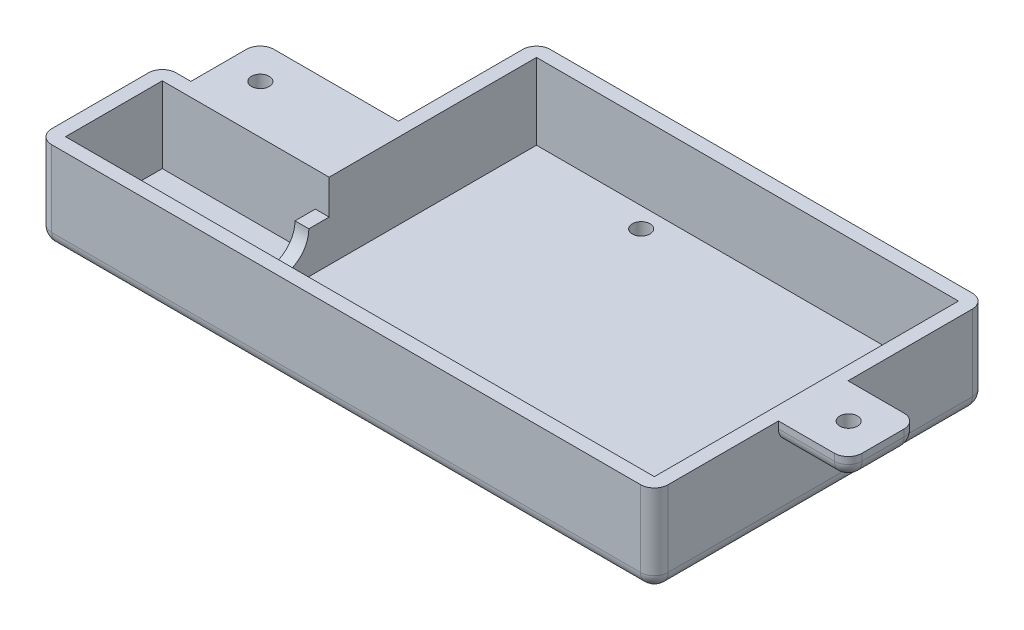
from build123d import *

# Parameters (mm, degrees)
STOCK_LED_START                   = -2.54
STOCK_LED_LIGHT_HOUSING_1_DEPTH   = 2.54
STOCK_LED_LIGHT_HOUSING_1_2_DEPTH = 13.97
SKETCH3_W                         = 2.54
SKETCH3_H                         = 17.78
PIECE_UNDER_BATTERY_PLUG_DEPTH    = 7.62
CUT_OUT_FOR_PLUG_REACH            = 94.065
SKETCH4_R                         = 5.157413323
HOLES_FOR_SCREWS_D                = 3.2639
SKETCH7_W                         = 25.4
SKETCH7_H                         = 12.726484406
SKETCH7_W_2                       = 12.813224924
SKETCH7_H_2                       = 12.784135739
NAILS_GO_HERE_DEPTH               = 3.81
NAIL_HOLES_D                      = 3.2639
FILLET1_R                         = 2.54


# Read off the part's stored shape, not the designer's step: Stock-LED Light housing-1
with BuildPart() as part:
    # Stock-LED Light housing-1 outline → Stock-LED Light housing-1 (new body)
    with BuildSketch(Plane(origin=(0, 0, 0), x_dir=(1, 0, 0), z_dir=(0, 1, 0)).offset(STOCK_LED_START)):
        Polygon((71.203772107, -22.802348667), (71.203772107, 38.157651333), (-11.408866572, 38.157651333), (-11.408866572, 0.057651333), (-42.066153873, 0.057651333), (-42.066153873, -22.802348667), align=None)
    extrude(amount=STOCK_LED_LIGHT_HOUSING_1_DEPTH)

    # Stock-LED Light housing-1 2 outline → Stock-LED Light housing-1 2 (add)
    with BuildSketch(Plane(origin=(0, 0, 0), x_dir=(1, 0, 0), z_dir=(0, 1, 0))):
        Polygon((71.203772107, -22.802348667), (71.203772107, 38.157651333), (-11.408866572, 38.157651333), (-11.408866572, 0.057651333), (-42.066153873, 0.057651333), (-42.066153873, -22.802348667), align=None)
        Polygon((-39.526153873, -20.262348667), (-39.526153873, -2.482348667), (-8.868866572, -2.482348667), (-8.868866572, 35.617651333), (68.663772107, 35.617651333), (68.663772107, -20.262348667), align=None, mode=Mode.SUBTRACT)
    extrude(amount=STOCK_LED_LIGHT_HOUSING_1_2_DEPTH)

    # Sketch3 → Piece under battery plug (add)
    with BuildSketch(Plane(origin=(0, 0, 0), x_dir=(1, 0, 0), z_dir=(0, 1, 0))):
        with Locations((-10.138866572, -11.372348667)):
            Rectangle(SKETCH3_W, SKETCH3_H)
    extrude(amount=PIECE_UNDER_BATTERY_PLUG_DEPTH)

    # Sketch4 → Cut out for plug (cut, up to next)
    with BuildSketch(Plane(origin=(-11.408866572, 0, 0), x_dir=(0, 0, -1), z_dir=(1, 0, 0)), mode=Mode.PRIVATE) as cut_out_for_plug_sk1:
        with Locations((-11.372348667, 7.62)):
            Circle(SKETCH4_R)
    cut_out_for_plug_tool1 = extrude(cut_out_for_plug_sk1.sketch, amount=CUT_OUT_FOR_PLUG_REACH, mode=Mode.PRIVATE) & part.part
    add(cut_out_for_plug_tool1.solids().sort_by_distance((-11.408867, 7.62, 11.372349))[0], mode=Mode.SUBTRACT)

    # holes for screws (through all)
    with Locations(Plane(origin=(0, 0, 0), x_dir=(1, 0, 0), z_dir=(0, 1, 0))):
        with Locations((14.053772107, 31.922137324), (12.783772107, -16.337862676), (64.853772107, -11.257862676), (64.853772107, 16.682137324)):
            Hole(HOLES_FOR_SCREWS_D / 2)

    # Sketch7 → Nails go here (add)
    with BuildSketch(Plane(origin=(0, 13.97, 0), x_dir=(1, 0, 0), z_dir=(0, 1, 0))):
        with Locations((-24.108866572, 6.420893536)):
            Rectangle(SKETCH7_W, SKETCH7_H)
        with Locations((77.610384569, 6.39206787)):
            Rectangle(SKETCH7_W_2, SKETCH7_H_2)
    extrude(amount=-NAILS_GO_HERE_DEPTH)

    # Nail holes (through all)
    with Locations(Plane(origin=(0, 10.16, 0), x_dir=(-1, 0, 0), z_dir=(0, -1, 0))):
        with Locations((30.430786564, 6.434135739), (-77.666997031, 6.434135739)):
            Hole(NAIL_HOLES_D / 2)

    # Fillet1
    fillet1_edges = [part.edges().sort_by_distance(p)[0] for p in [
        (71.203772107, 5.715, -38.157651333),
        (71.203772107, 5.715, 22.802348667),
        (-36.808866572, 10.16, -6.420893536),
        (-24.108866572, 10.16, -12.784135739),
        (-36.808866572, 12.065, -12.784135739),
        (77.610384569, 10.16, -12.784135739),
        (84.016997031, 10.16, -6.392067869),
        (84.016997031, 12.065, -12.784135739),
        (77.610384569, 10.16, 0),
        (84.016997031, 12.065, 0),
        (-26.737510222, -2.54, -0.057651333),
        (14.568809117, -2.54, 22.802348667),
        (29.897452767, -2.54, -38.157651333),
        (-42.066153873, 5.715, 22.802348667),
        (-42.066153873, 5.715, -0.057651333),
        (-42.066153873, -2.54, 11.372348667),
        (71.203772107, -2.54, -7.677651333),
        (-11.408866572, 5.715, -38.157651333),
        (-11.408866572, -2.54, -19.107651333),
    ]]
    fillet(fillet1_edges, radius=FILLET1_R)


solid = part.part
